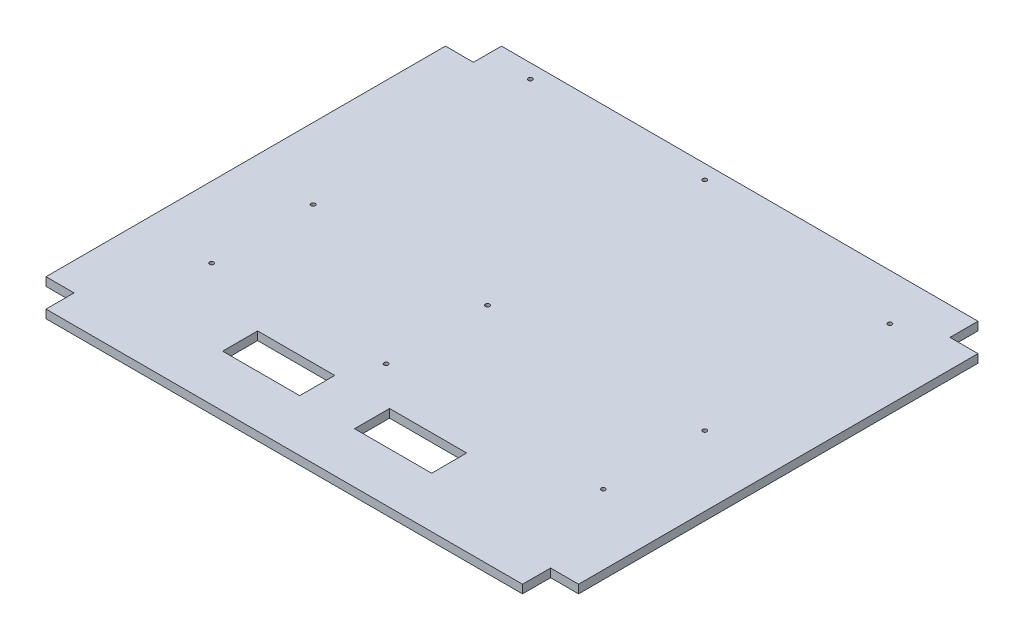
from build123d import *

# Parameters (mm, degrees)
BASE_PLATE_W        = 380
BASE_PLATE_H        = 325
BASE_PLATE_R        = 1.5
BASE_PLATE_R_2      = 2.5
BASE_PLATE_W_2      = 55
BASE_PLATE_H_2      = 25
BOSS_EXTRUDE1_DEPTH = 6
SKETCH1_W           = 20
SKETCH1_H           = 20
CUT_EXTRUDE1_DEPTH  = 10


with BuildPart() as part:
    # Base Plate → Boss-Extrude1 (new body)
    with BuildSketch(Plane(origin=(0, 0, 0), x_dir=(1, 0, 0), z_dir=(0, 1, 0))):
        Rectangle(BASE_PLATE_W, BASE_PLATE_H)
        with Locations((-139.29, -74.99)):
            Circle(BASE_PLATE_R, mode=Mode.SUBTRACT)
        with Locations((-14.83, -2.6)):
            Circle(BASE_PLATE_R, mode=Mode.SUBTRACT)
        with Locations((-139.29, -2.6)):
            Circle(BASE_PLATE_R, mode=Mode.SUBTRACT)
        with Locations((-139.29, 152.34)):
            Circle(BASE_PLATE_R, mode=Mode.SUBTRACT)
        with Locations((-14.83, 152.34)):
            Circle(BASE_PLATE_R, mode=Mode.SUBTRACT)
        with Locations((-14.83, -74.99)):
            Circle(BASE_PLATE_R, mode=Mode.SUBTRACT)
        with Locations((140.11, -74.99)):
            Circle(BASE_PLATE_R, mode=Mode.SUBTRACT)
        with Locations((140.11, -2.6)):
            Circle(BASE_PLATE_R, mode=Mode.SUBTRACT)
        with Locations((140.11, 129.48)):
            Circle(BASE_PLATE_R, mode=Mode.SUBTRACT)
        with Locations((-180, -152.5)):
            Circle(BASE_PLATE_R_2, mode=Mode.SUBTRACT)
        with Locations((180, -152.5)):
            Circle(BASE_PLATE_R_2, mode=Mode.SUBTRACT)
        with Locations((-180, 152.5)):
            Circle(BASE_PLATE_R_2, mode=Mode.SUBTRACT)
        with Locations((180, 152.5)):
            Circle(BASE_PLATE_R_2, mode=Mode.SUBTRACT)
        with Locations((41.5, -113.84)):
            Rectangle(BASE_PLATE_W_2, BASE_PLATE_H_2, mode=Mode.SUBTRACT)
        with Locations((-53.5, -113)):
            Rectangle(BASE_PLATE_W_2, BASE_PLATE_H_2, mode=Mode.SUBTRACT)
    extrude(amount=BOSS_EXTRUDE1_DEPTH)

    # Sketch1 → Cut-Extrude1 (cut)
    with BuildSketch(Plane(origin=(0, 6, 0), x_dir=(1, 0, 0), z_dir=(0, 1, 0))):
        with Locations((-180, 152.5)):
            Rectangle(SKETCH1_W, SKETCH1_H)
        with Locations((180, 152.5)):
            Rectangle(SKETCH1_W, SKETCH1_H)
        with Locations((180, -152.5)):
            Rectangle(SKETCH1_W, SKETCH1_H)
        with Locations((-180, -152.5)):
            Rectangle(SKETCH1_W, SKETCH1_H)
    extrude(amount=-CUT_EXTRUDE1_DEPTH, mode=Mode.SUBTRACT)


solid = part.part
